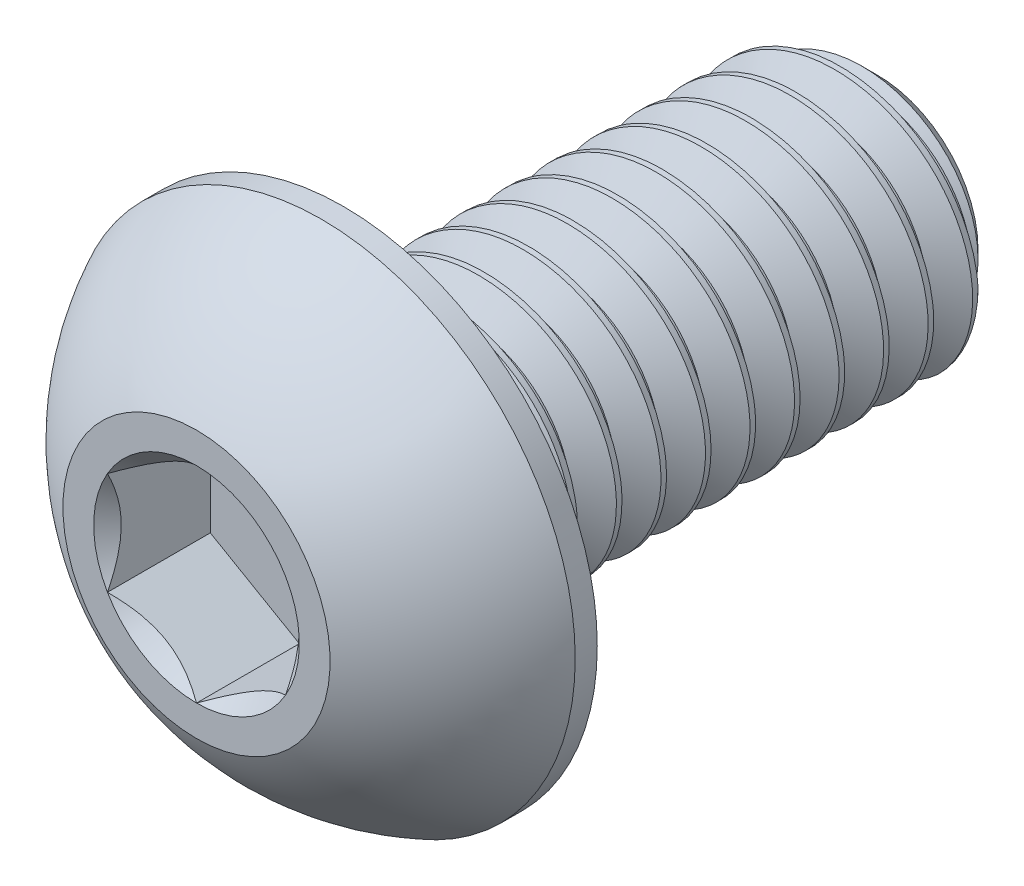
from build123d import *

# Parameters (mm, degrees)
CUT_EXTRUDE2_DEPTH = 1.155
CUT_SWEEP2_PITCH   = 0.5


# Read off the part's stored shape, not the designer's step: Split1, Boss-Extrude1
with BuildPart() as part:
    # Sketch10 → Revolve3 (revolve)
    with BuildSketch(Plane(origin=(0, 0, 0), x_dir=(0, 0, -1), z_dir=(1, 0, 0)), mode=Mode.PRIVATE) as revolve3_sk:
        Polygon((7.275, 1.5), (7.65, 1.125), (7.65, 0), (1.65, 0), (1.65, 1.5), align=None)
    revolve(revolve3_sk.sketch.rotate(Axis((0, 0, 0), (0, 0, -1)), 90), axis=Axis((0, 0, 0), (0, 0, -1)))

    # Sketch7 → Revolve2 (revolve)
    with BuildSketch(Plane(origin=(0, 0, 0), x_dir=(0, 0, -1), z_dir=(1, 0, 0)), mode=Mode.PRIVATE) as revolve2_sk:
        with BuildLine():
            Line((1.4025, 2.85), (1.65, 2.85))
            Line((1.65, 2.85), (1.65, 0))
            Line((1.65, 0), (0, 0))
            Line((0, 0), (0, 1.5))
            ThreePointArc((0, 1.5), (0.59512511, 2.285251969), (1.4025, 2.85))
        make_face()
    revolve(revolve2_sk.sketch.rotate(Axis((0, 0, 0), (0, 0, -1)), 180), axis=Axis((0, 0, 0), (0, 0, -1)))

    # Sketch5 → Cut-Extrude2 (cut)
    with BuildSketch(Plane.XY):
        Polygon((1, -0.577350269), (1, 0.577350269), (0, 1.154700538), (-1, 0.577350269), (-1, -0.577350269), (0, -1.154700538), align=None)
    extrude(amount=-CUT_EXTRUDE2_DEPTH, mode=Mode.SUBTRACT)

    # Cut-Extrude3 cone 1 section (through the dimple's axis) → Cut-Extrude3 (revolve, cut)
    with BuildSketch(Plane(origin=(0, 0, 0), x_dir=(0, -1, 0), z_dir=(1, 0, 0))):
        Polygon((0, 0), (1.154700538, 0), (0, 1.154700538), align=None)
    revolve(axis=Axis((0, 0, 0), (0, 0, -1)), mode=Mode.SUBTRACT)


with BuildPart() as body_2:
    # Split1: the piece on the far side of the plane
    add(part.part)
    split(bisect_by=Plane.XY.offset(-1.65), keep=Keep.BOTTOM)

    # Cut-Sweep2: the profile of Sketch12 screwed along a right-hand helix of 15.3 turns, 6 arcs to a turn; built about Z, then put on its axis
    cut_sweep2_z = Axis((0, 0, 0), (0, 0, 1))
    cut_sweep2_corners = [(1.175240474, 0, -0.1875), (1.175240474, 0, -0.25), (1.527063294, 0, -0.453125), (1.527063294, 0, 0.015625)]
    with BuildLine(mode=Mode.PRIVATE) as cut_sweep2_profile:
        Line(cut_sweep2_corners[0], cut_sweep2_corners[1])
        Line(cut_sweep2_corners[1], cut_sweep2_corners[2])
        Line(cut_sweep2_corners[2], cut_sweep2_corners[3])
        Line(cut_sweep2_corners[3], cut_sweep2_corners[0])
    cut_sweep2_cap = Face(cut_sweep2_profile.wire())
    cut_sweep2_turn_angles = [0, 30, 60, 90, 120, 150, 180, 210, 240, 270, 300, 330, 360]
    cut_sweep2_turn_weights = [1, 0.8660254037844387, 1, 0.8660254037844387, 1, 0.8660254037844387, 1, 0.8660254037844387, 1, 0.8660254037844387, 1, 0.8660254037844387, 1]
    cut_sweep2_turn_rails = [Edge.make_bspline([Vector(p[0], p[1], 0).rotate(cut_sweep2_z, cut_sweep2_turn_angles[k]) / cut_sweep2_turn_weights[k] + Vector(0, 0, p[2] + CUT_SWEEP2_PITCH * cut_sweep2_turn_angles[k] / 360) for k in range(13)], [0, 0, 0, 1, 1, 2, 2, 3, 3, 4, 4, 5, 5, 6, 6, 6], 2, cut_sweep2_turn_weights) for p in cut_sweep2_corners]
    cut_sweep2_turn_sides = [Face.make_surface_from_curves(cut_sweep2_turn_rails[p[0]], cut_sweep2_turn_rails[p[1]]) for p in [(0, 1), (1, 2), (2, 3), (3, 0)]]
    cut_sweep2_last_angles = [5400, 5430, 5460, 5484, 5508]
    cut_sweep2_last_weights = [1, 0.8660254037844387, 1, 0.9135454576424201, 1]
    cut_sweep2_last_rails = [Edge.make_bspline([Vector(p[0], p[1], 0).rotate(cut_sweep2_z, cut_sweep2_last_angles[k]) / cut_sweep2_last_weights[k] + Vector(0, 0, p[2] + CUT_SWEEP2_PITCH * cut_sweep2_last_angles[k] / 360) for k in range(5)], [0, 0, 0, 1, 1, 2, 2, 2], 2, cut_sweep2_last_weights) for p in cut_sweep2_corners]
    cut_sweep2_last_sides = [Face.make_surface_from_curves(cut_sweep2_last_rails[p[0]], cut_sweep2_last_rails[p[1]]) for p in [(0, 1), (1, 2), (2, 3), (3, 0)]]
    cut_sweep2 = Plane(origin=(0, 0, -7.65), x_dir=(0, 1, 0), z_dir=(0, 0, 1)) * Solid(Shell([*[p.moved(Location((0, 0, CUT_SWEEP2_PITCH * i))) for i in range(15) for p in cut_sweep2_turn_sides], *cut_sweep2_last_sides, cut_sweep2_cap, cut_sweep2_cap.rotate(cut_sweep2_z, 5508).moved(Location((0, 0, CUT_SWEEP2_PITCH * 5508 / 360)))]))
    add(cut_sweep2, mode=Mode.SUBTRACT)


with BuildPart() as part_1:
    add(part.part)

    # Split1
    split(bisect_by=Plane.XY.offset(-1.65), keep=Keep.TOP)

    add(body_2.part)  # Boss-Extrude1 merges body 2
    # Boss-Extrude1 outline → Boss-Extrude1 (revolve)
    with BuildSketch(Plane.XZ):
        Polygon((1.175240474, -1.65), (1.175240474, -1.974759526), (1.5, -1.65), align=None)
    revolve(axis=Axis((0, 0, 0), (0, 0, 1)))


solid = part_1.part
